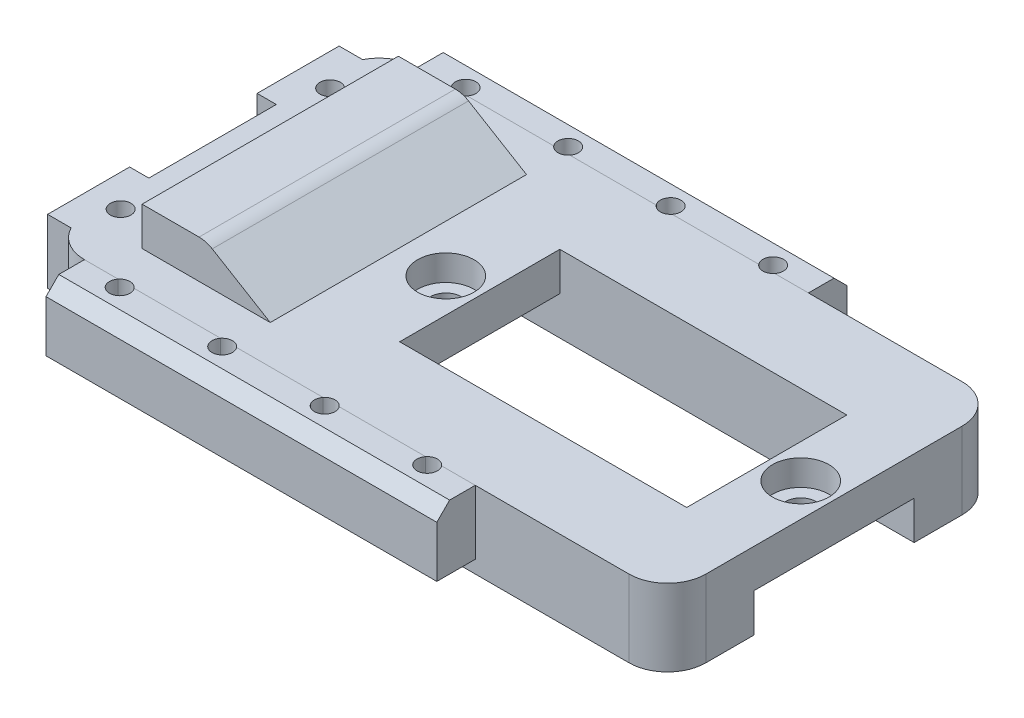
from build123d import *

# Parameters (mm, degrees)
SKETCH_1_W                   = 48.5
SKETCH_1_H                   = 26
EXTRUDE_1_DEPTH              = 6
SKETCH_2_W                   = 22.4
SKETCH_2_H                   = 12.5
CUT_EXTRUDE_1_DEPTH          = 6.7
CUT_EXTRUDE_2_DEPTH          = 3
HOLE_WIZARD_M2_1_D           = 2.4
HOLE_WIZARD_M2_1_CBORE_D     = 4.4
HOLE_WIZARD_M2_1_CBORE_DEPTH = 2
SKETCH_6_W                   = 10
SKETCH_6_H                   = 20
EXTRUDE_2_DEPTH              = 3
CUT_EXTRUDE_3_DEPTH          = 35.61303945
FILLET_2_R                   = 2
FILLET_3_R                   = 3
SKETCH_8_W                   = 30.5
SKETCH_8_H                   = 3
EXTRUDE_3_DEPTH              = 5
EXTRUDE_3_2_DEPTH            = 5
M2X0_4_1_DEPTH               = 6
CHAMFER_1_SIZE               = 1
CHAMFER_3_SIZE               = 1
EXTRUDE_5_DEPTH              = 5
M2X0_4_3_OUTLINE_R           = 0.8
M2X0_4_3_DEPTH               = 6


# Read off the part's stored shape, not the designer's step: M2x0.4 螺纹孔1, M2x0.4 螺纹孔3
with BuildPart() as part:
    # 草图1 → 凸台-拉伸1 (new body)
    with BuildSketch(Plane(origin=(0, 0, 0), x_dir=(1, 0, 0), z_dir=(0, 1, 0))):
        Rectangle(SKETCH_1_W, SKETCH_1_H)
    extrude(amount=EXTRUDE_1_DEPTH)

    # 草图2 → 切除-拉伸1 (cut)
    with BuildSketch(Plane.XZ):
        with Locations((7.8, 0)):
            Rectangle(SKETCH_2_W, SKETCH_2_H)
    extrude(amount=-CUT_EXTRUDE_1_DEPTH, mode=Mode.SUBTRACT)

    # 草图3 → 切除-拉伸2 (cut)
    with BuildSketch(Plane.XZ):
        Polygon((19, -6.25), (-3.4, -6.25), (-8.1, -6.25), (-8.1, 6.25), (-3.4, 6.25), (19, 6.25), (23.7, 6.25), (24.25, 6.25), (24.25, -6.25), (23.7, -6.25), align=None)
    extrude(amount=-CUT_EXTRUDE_2_DEPTH, mode=Mode.SUBTRACT)

    # M2 凹头盖螺钉的柱形沉头孔1 (through all)
    with Locations(Plane(origin=(-6.05, 6, 0), x_dir=(0, 0, 1), z_dir=(0, 1, 0))):
        with Locations((0, 0), (0, 27.7)):
            CounterBoreHole(HOLE_WIZARD_M2_1_D / 2, HOLE_WIZARD_M2_1_CBORE_D / 2, HOLE_WIZARD_M2_1_CBORE_DEPTH)

    # 草图6 → 凸台-拉伸2 (add)
    with BuildSketch(Plane(origin=(0, 6, 0), x_dir=(1, 0, 0), z_dir=(0, 1, 0))):
        with Locations((-14.75, 0)):
            Rectangle(SKETCH_6_W, SKETCH_6_H)
    extrude(amount=EXTRUDE_2_DEPTH)

    # 草图7 → 切除-拉伸3 (cut, through all)
    with BuildSketch(Plane.XY.offset(10)):
        Polygon((-9.75, 6), (-14.75, 9), (-9.75, 9), align=None)
    extrude(amount=-CUT_EXTRUDE_3_DEPTH, mode=Mode.SUBTRACT)

    # 圆角2
    fillet_2_edges = [part.edges().sort_by_distance(p)[0] for p in [
        (-14.75, 9, 0),
    ]]
    fillet(fillet_2_edges, radius=FILLET_2_R)

    # 圆角3
    fillet_3_edges = [part.edges().sort_by_distance(p)[0] for p in [
        (24.25, 3, 13),
        (-24.25, 3, 13),
        (-24.25, 3, -13),
        (24.25, 3, -13),
    ]]
    fillet(fillet_3_edges, radius=FILLET_3_R)


with BuildPart() as body_2:
    # 草图8 → 凸台-拉伸3 (new body)
    with BuildSketch(Plane(origin=(0, 6, 0), x_dir=(1, 0, 0), z_dir=(0, 1, 0))):
        with Locations((-6, -14.5)):
            Rectangle(SKETCH_8_W, SKETCH_8_H)
    extrude(amount=-EXTRUDE_3_DEPTH)


with BuildPart() as body_3:
    # 草图8 → Extrude 3 2 (new body)
    with BuildSketch(Plane(origin=(0, 6, 0), x_dir=(1, 0, 0), z_dir=(0, 1, 0))):
        with Locations((-6, 14.5)):
            Rectangle(SKETCH_8_W, SKETCH_8_H)
    extrude(amount=-EXTRUDE_3_2_DEPTH)


with BuildPart() as m2x0_4_1_tool:
    # M2x0.4 螺纹孔1 outline → M2x0.4 螺纹孔1 (new body)
    with BuildSketch(Plane(origin=(0, 0, 0), x_dir=(1, 0, 0), z_dir=(0, 1, 0))):
        with BuildLine():
            ThreePointArc((6.6244998, 13), (6, 14.3), (5.3755002, 13))
            ThreePointArc((5.3755002, 13), (6, 12.7), (6.6244998, 13))
        make_face()
        with BuildLine():
            ThreePointArc((-18.6244998, 13), (-18, 12.7), (-17.3755002, 13))
            ThreePointArc((-17.3755002, 13), (-18, 14.3), (-18.6244998, 13))
        make_face()
        with BuildLine():
            ThreePointArc((-10.6244998, 13), (-10, 12.7), (-9.3755002, 13))
            ThreePointArc((-9.3755002, 13), (-10, 14.3), (-10.6244998, 13))
        make_face()
        with BuildLine():
            ThreePointArc((-2.6244998, 13), (-2, 12.7), (-1.3755002, 13))
            ThreePointArc((-1.3755002, 13), (-2, 14.3), (-2.6244998, 13))
        make_face()
        with BuildLine():
            ThreePointArc((-18.6244998, -13), (-18, -14.3), (-17.3755002, -13))
            ThreePointArc((-17.3755002, -13), (-18, -12.7), (-18.6244998, -13))
        make_face()
        with BuildLine():
            ThreePointArc((6.6244998, -13), (6, -12.7), (5.3755002, -13))
            ThreePointArc((5.3755002, -13), (6, -14.3), (6.6244998, -13))
        make_face()
        with BuildLine():
            ThreePointArc((-1.3755002, -13), (-2, -12.7), (-2.6244998, -13))
            ThreePointArc((-2.6244998, -13), (-2, -14.3), (-1.3755002, -13))
        make_face()
        with BuildLine():
            ThreePointArc((-9.3755002, -13), (-10, -12.7), (-10.6244998, -13))
            ThreePointArc((-10.6244998, -13), (-10, -14.3), (-9.3755002, -13))
        make_face()
    extrude(amount=M2X0_4_1_DEPTH)


with BuildPart() as part_1:
    add(part.part)

    # M2x0.4 螺纹孔1: cut by m2x0_4_1_tool
    add(m2x0_4_1_tool.part, mode=Mode.SUBTRACT)

    # 草图17 → 凸台-拉伸5 (add)
    with BuildSketch(Plane(origin=(0, 6, 0), x_dir=(1, 0, 0), z_dir=(0, 1, 0))):
        Polygon((-23.977178029, 11.375), (-23.894080215, 11.375), (-24.25, 10), (-24.25, 4.975), (-25.75, 4.975), (-25.75, 11.375), align=None)
        Polygon((-25.75, -4.975), (-24.25, -4.975), (-24.25, -10), (-23.853349066, -11.375), (-23.977178029, -11.375), (-25.75, -11.375), align=None)
    extrude(amount=-EXTRUDE_5_DEPTH)

    # M2x0.4 螺纹孔3 outline → M2x0.4 螺纹孔3 (cut)
    with BuildSketch(Plane(origin=(0, 0, 0), x_dir=(1, 0, 0), z_dir=(0, 1, 0))):
        with Locations((-23.25, -8.175)):
            Circle(M2X0_4_3_OUTLINE_R)
        with Locations((-23.25, 8.175)):
            Circle(M2X0_4_3_OUTLINE_R)
    extrude(amount=M2X0_4_3_DEPTH, mode=Mode.SUBTRACT)


with BuildPart() as body_2_1:
    add(body_2.part)

    # M2x0.4 螺纹孔1: cut by m2x0_4_1_tool
    add(m2x0_4_1_tool.part, mode=Mode.SUBTRACT)

    # 倒角1
    chamfer_1_edges = [body_2_1.edges().sort_by_distance(p)[0] for p in [
        (-6, 6, 16),
    ]]
    chamfer(chamfer_1_edges, length=CHAMFER_1_SIZE)


with BuildPart() as body_3_1:
    add(body_3.part)

    # M2x0.4 螺纹孔1: cut by m2x0_4_1_tool
    add(m2x0_4_1_tool.part, mode=Mode.SUBTRACT)

    # 倒角3
    chamfer_3_edges = [body_3_1.edges().sort_by_distance(p)[0] for p in [
        (-6, 6, -16),
    ]]
    chamfer(chamfer_3_edges, length=CHAMFER_3_SIZE)


solid = Compound([part_1.part, body_2_1.part, body_3_1.part])
